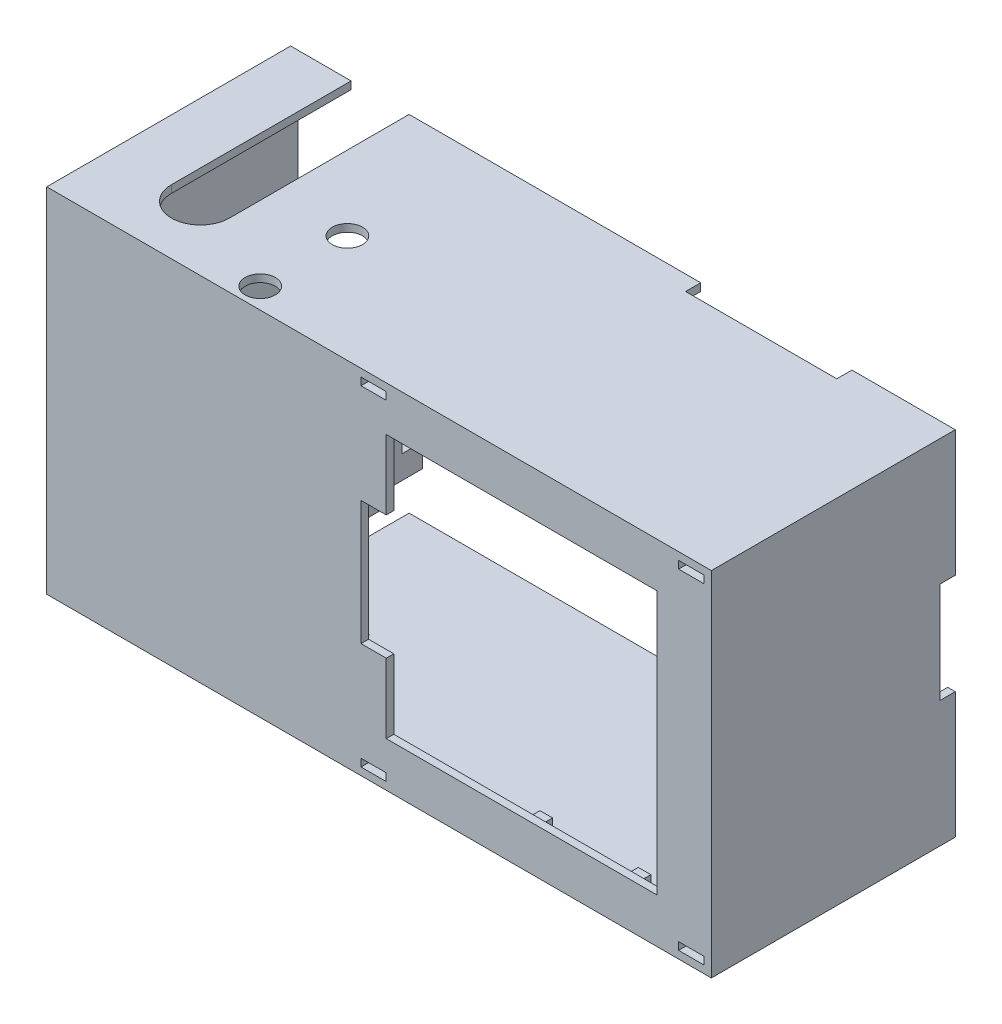
from build123d import *

# Parameters (mm, degrees)
SKETCH1_W                 = 131.85
SKETCH1_H                 = 70
BOSS_EXTRUDE1_DEPTH       = 1.5
SKETCH1_5_W               = 131.85
SKETCH1_5_H               = 70
SKETCH1_5_W_2             = 128.85
SKETCH1_5_H_2             = 67
BOSS_EXTRUDE2_DEPTH       = 46.887495
SKETCH2_W                 = 5.8
SKETCH2_H                 = 7.525
BOSS_EXTRUDE3_DEPTH       = 67
CAVITY1_START             = -114.930353249
CAVITY1_DEPTH             = 49.266
CAVITY1_2_DEPTH           = 37.332
CAVITY1_START_2           = -120.030353249
CAVITY1_3_OUTLINE_W       = 2.55
CAVITY1_3_OUTLINE_H       = 5.1
CAVITY1_3_DEPTH           = 0.430353249
CAVITY1_START_3           = -9.75
CAVITY1_4_DEPTH           = 70
SKETCH5_W                 = 8.75
SKETCH5_H                 = 5
BOSS_EXTRUDE4_DEPTH       = 22.5
CUT_EXTRUDE3_REACH        = 139.739
SKETCH6_R                 = 1.5
SKETCH6_R_2               = 1
CUT_EXTRUDE18_DEPTH       = 1.15
CUT_EXTRUDE18_DEPTH_BACK  = 1.15
CUT_EXTRUDE18_START       = -2.5
CUT_EXTRUDE19_DEPTH       = 1.15
CUT_EXTRUDE19_DEPTH_BACK  = 1.15
CUT_EXTRUDE19_START       = -19.7
SKETCH9_W                 = 32.1
SKETCH9_H                 = 12.2
SKETCH9_W_2               = 3.3625
BOSS_EXTRUDE5_DEPTH       = 40.087495374
SKETCH10_W                = 22.5
SKETCH10_H                = 15.7
CUT_EXTRUDE6_DEPTH        = 12.2
SKETCH11_R                = 0.75
CUT_EXTRUDE7_DEPTH        = 8
CUT_EXTRUDE9_REACH        = 149.525
SKETCH17_W                = 2.4375
SKETCH17_H                = 12.2
CUT_EXTRUDE13_DEPTH       = 7.525
SKETCH20_W                = 2.5
SKETCH20_H                = 3
BOSSBATTERYSTUBS_DEPTH    = 5.75
MIRROR10_COPY_1_SKETCH_W  = 2.5
MIRROR10_COPY_1_SKETCH_H  = 3
MIRROR10_COPY_1_DEPTH     = 5.75
SKETCH21_W                = 8
SKETCH21_H                = 4.2
BODYTOPCANTPOSBOSS_DEPTH  = 1.35
MIRROR12_COPY_1_SKETCH_W  = 8
MIRROR12_COPY_1_SKETCH_H  = 4.2
MIRROR12_COPY_1_DEPTH     = 1.35
PCBHOLDERCANTNEGCUT_REACH = 145.655
SKETCH22_W                = 5
SKETCH22_H                = 1.5
SKETCH23_W                = 5
SKETCH23_H                = 1.5
CUT_EXTRUDE17_DEPTH       = 3
PCBHOLDERACCESSCUT_REACH  = 145.156
CUT_EXTRUDE15_START       = -5.25
SKETCH19_R                = 3
CUT_EXTRUDE15_DEPTH       = 5.25
CUT_EXTRUDE24_START       = -5.25
SKETCH28_R                = 3
CUT_EXTRUDE24_DEPTH       = 5.25
CUT_EXTRUDE25_REACH       = 117.926
SKETCH29_W                = 8
SKETCH29_H                = 3
SKETCH30_W                = 5.1
SKETCH30_H                = 2.55
BOSSFRONTCAVITYFIX_DEPTH  = 0.430353249
CUT_EXTRUDE26_DEPTH       = 4.8
CUT_EXTRUDE27_REACH       = 149.525
SKETCH32_W                = 30
SKETCH32_H                = 3
CUT_EXTRUDE28_REACH       = 154.358
SKETCH33_W                = 3
SKETCH33_H                = 20


# Read off the part's stored shape, not the designer's step: Cavity1
with BuildPart() as part:
    # Sketch1 → Boss-Extrude1 (new body)
    with BuildSketch(Plane.XY):
        with Locations((-55.175, 25.25)):
            Rectangle(SKETCH1_W, SKETCH1_H)
    extrude(amount=BOSS_EXTRUDE1_DEPTH)

    # Sketch1<5> → Boss-Extrude2 (add)
    with BuildSketch(Plane.XY):
        with Locations((-55.175, 25.25)):
            Rectangle(SKETCH1_5_W, SKETCH1_5_H)
        with Locations((-55.175, 25.25)):
            Rectangle(SKETCH1_5_W_2, SKETCH1_5_H_2, mode=Mode.SUBTRACT)
    extrude(amount=-BOSS_EXTRUDE2_DEPTH)

    # Sketch2 → Boss-Extrude3 (add)
    with BuildSketch(Plane.XZ.offset(-58.75)):
        with Locations((-76.95, -3.7625)):
            Rectangle(SKETCH2_W, SKETCH2_H)
    extrude(amount=BOSS_EXTRUDE3_DEPTH)

    # Cavity1 outline → Cavity1 (cut)
    with BuildSketch(Plane.YZ.offset(CAVITY1_START)):
        with BuildLine():
            Line((36.166540929, -4.011412776), (36.166540929, -7.525))
            Line((36.166540929, -7.525), (53.710540929, -7.525))
            Line((53.710540929, -7.525), (53.710540929, -4.011412776))
            ThreePointArc((53.710540929, -4.011412776), (44.938540929, 0.123), (36.166540929, -4.011412776))
        make_face()
        with BuildLine():
            Line((14.333459071, -7.525), (14.333459071, -4.011412776))
            ThreePointArc((14.333459071, -4.011412776), (5.561459071, 0.123), (-3.210540929, -4.011412776))
            Line((-3.210540929, -4.011412776), (-3.210540929, -7.525))
            Line((-3.210540929, -7.525), (14.333459071, -7.525))
        make_face()
    extrude(amount=CAVITY1_DEPTH, mode=Mode.SUBTRACT)

    # Cavity1 2 outline → Cavity1 2 (cut)
    with BuildSketch(Plane.YZ.offset(CAVITY1_START)):
        with BuildLine():
            Line((55.189540929, 0.225), (36.166540929, 0.225))
            Line((36.166540929, 0.225), (36.166540929, -4.011412776))
            ThreePointArc((36.166540929, -4.011412776), (44.938540929, 0.123), (53.710540929, -4.011412776))
            Line((53.710540929, -4.011412776), (53.710540929, -7.525))
            Line((53.710540929, -7.525), (55.189540929, -7.525))
            Line((55.189540929, -7.525), (55.189540929, 0.225))
        make_face()
        with BuildLine():
            Line((14.333459071, -4.011412776), (14.333459071, 0.225))
            Line((14.333459071, 0.225), (-4.689540929, 0.225))
            Line((-4.689540929, 0.225), (-4.689540929, -7.525))
            Line((-4.689540929, -7.525), (-3.210540929, -7.525))
            Line((-3.210540929, -7.525), (-3.210540929, -4.011412776))
            ThreePointArc((-3.210540929, -4.011412776), (5.561459071, 0.123), (14.333459071, -4.011412776))
        make_face()
    extrude(amount=CAVITY1_2_DEPTH, mode=Mode.SUBTRACT)

    # Cavity1 3 outline → Cavity1 3 (cut)
    with BuildSketch(Plane.YZ.offset(CAVITY1_START_2)):
        with Locations((44.938540929, -11.25)):
            Rectangle(CAVITY1_3_OUTLINE_W, CAVITY1_3_OUTLINE_H)
        with Locations((5.561459071, -11.25)):
            Rectangle(CAVITY1_3_OUTLINE_W, CAVITY1_3_OUTLINE_H)
    extrude(amount=CAVITY1_3_DEPTH, mode=Mode.SUBTRACT)

    # Cavity1 4 outline → Cavity1 4 (cut)
    with BuildSketch(Plane(origin=(0, 0, 0), x_dir=(1, 0, 0), z_dir=(0, 1, 0)).offset(CAVITY1_START_3)):
        with BuildLine():
            Line((-105.571853249, 13.174532151), (-105.571853249, 9.325467849))
            ThreePointArc((-105.571853249, 9.325467849), (-103.710353249, 8.5725), (-101.848853249, 9.325467849))
            Line((-101.848853249, 9.325467849), (-101.848853249, 13.174532151))
            ThreePointArc((-101.848853249, 13.174532151), (-103.710353249, 13.9275), (-105.571853249, 13.174532151))
        make_face()
    extrude(amount=CAVITY1_4_DEPTH, mode=Mode.SUBTRACT)

    # Sketch5 → Boss-Extrude4 (add)
    with BuildSketch(Plane(origin=(0, 0, 0), x_dir=(-1, 0, 0), z_dir=(0, 0, -1))):
        with Locations((82.85, 33.85)):
            Rectangle(SKETCH5_W, SKETCH5_H)
    boss_extrude4 = extrude(amount=BOSS_EXTRUDE4_DEPTH)

    # Sketch6 → Cut-Extrude3 (cut, up to next)
    with BuildSketch(Plane(origin=(0, 36.166540929, 0), x_dir=(1, 0, 0), z_dir=(0, 1, 0)), mode=Mode.PRIVATE) as cut_extrude3_sk1:
        with Locations(Location((-82.85, 19.9, 0), (0, 0, 270))):
            Circle(SKETCH6_R)
    cut_extrude3_tool1 = extrude(cut_extrude3_sk1.sketch, amount=-CUT_EXTRUDE3_REACH, mode=Mode.PRIVATE) & part.part
    # Sketch6 → Cut-Extrude3 (cut, up to next)
    with BuildSketch(Plane(origin=(0, 36.166540929, 0), x_dir=(1, 0, 0), z_dir=(0, 1, 0)), mode=Mode.PRIVATE) as cut_extrude3_sk2:
        with Locations(Location((-82.85, 2.6, 0), (0, 0, 270))):
            Circle(SKETCH6_R_2)
    cut_extrude3_tool2 = extrude(cut_extrude3_sk2.sketch, amount=-CUT_EXTRUDE3_REACH, mode=Mode.PRIVATE) & part.part
    cut_extrude3_1 = cut_extrude3_tool1.solids().sort_by_distance((-82.85, 36.166541, -19.9))[0]
    add(cut_extrude3_1, mode=Mode.SUBTRACT)
    cut_extrude3_2 = cut_extrude3_tool2.solids().sort_by_distance((-82.85, 36.166541, -2.6))[0]
    add(cut_extrude3_2, mode=Mode.SUBTRACT)
    cut_extrude3 = cut_extrude3_1 + cut_extrude3_2  # Cut-Extrude3 as one shape, for the pattern or mirror that repeats it

    # Sketch24 → Cut-Extrude18 (cut, two sides: drawn at the far end of the back side and taken through both)
    with BuildSketch(Plane(origin=(0, 36.35, 0), x_dir=(1, 0, 0), z_dir=(0, 1, 0)).offset(CUT_EXTRUDE18_START - CUT_EXTRUDE18_DEPTH_BACK)):
        Polygon((-82.85, 16.637970979), (-80.025, 18.26898549), (-80.025, 22.5), (-85.675, 22.5), (-85.675, 18.26898549), align=None)
    extrude(amount=CUT_EXTRUDE18_DEPTH + CUT_EXTRUDE18_DEPTH_BACK, mode=Mode.SUBTRACT)

    # Mirror15: Boss-Extrude4, Cut-Extrude3 across plane
    add(boss_extrude4.mirror(Plane(origin=(0, 25.25, 0), x_dir=(0, 0, 1), z_dir=(0, -1, 0))))
    add(cut_extrude3.mirror(Plane(origin=(0, 25.25, 0), x_dir=(0, 0, 1), z_dir=(0, -1, 0))), mode=Mode.SUBTRACT)

    # Sketch24<2> → Cut-Extrude19 (cut, two sides: drawn at the far end of the back side and taken through both)
    with BuildSketch(Plane(origin=(0, 36.35, 0), x_dir=(1, 0, 0), z_dir=(0, 1, 0)).offset(CUT_EXTRUDE19_START - CUT_EXTRUDE19_DEPTH_BACK)):
        Polygon((-82.85, 16.637970979), (-80.025, 18.26898549), (-80.025, 22.5), (-85.675, 22.5), (-85.675, 18.26898549), align=None)
    extrude(amount=CUT_EXTRUDE19_DEPTH + CUT_EXTRUDE19_DEPTH_BACK, mode=Mode.SUBTRACT)

    # Sketch9 → Boss-Extrude5 (add)
    with BuildSketch(Plane(origin=(0, 0, 0), x_dir=(-1, 0, 0), z_dir=(0, 0, -1))):
        with Locations((92.5375, 25.25)):
            Rectangle(SKETCH9_W, SKETCH9_H)
        with Locations((78.16875, 25.25)):
            Rectangle(SKETCH9_W_2, SKETCH9_H)
    extrude(amount=BOSS_EXTRUDE5_DEPTH)

    # Sketch10 → Cut-Extrude6 (cut)
    with BuildSketch(Plane(origin=(0, 31.35, 0), x_dir=(1, 0, 0), z_dir=(0, 1, 0))):
        with Locations((-92.5375, 32.237495374)):
            Rectangle(SKETCH10_W, SKETCH10_H)
    extrude(amount=-CUT_EXTRUDE6_DEPTH, mode=Mode.SUBTRACT)

    # Sketch11 → Cut-Extrude7 (cut)
    with BuildSketch(Plane(origin=(0, 0, -40.087495374), x_dir=(-1, 0, 0), z_dir=(0, 0, -1))):
        with Locations((106.1875, 25.25)):
            Circle(SKETCH11_R)
    cut_extrude7 = extrude(amount=-CUT_EXTRUDE7_DEPTH, mode=Mode.SUBTRACT)

    # Sketch13 → Cut-Extrude9 (cut, up to next)
    with BuildSketch(Plane(origin=(0, 60.25, 0), x_dir=(1, 0, 0), z_dir=(0, 1, 0)), mode=Mode.PRIVATE) as cut_extrude9_sk1:
        with BuildLine():
            Line((-109.1, 46.887495374), (-109.1, 11.25))
            ThreePointArc((-109.1, 11.25), (-103.35, 5.5), (-97.6, 11.25))
            Line((-97.6, 11.25), (-97.6, 46.887495374))
            Line((-97.6, 46.887495374), (-109.1, 46.887495374))
        make_face()
        with BuildLine():
            Line((-105.571853249, 9.325467849), (-105.571853249, 13.174532151))
            ThreePointArc((-105.571853249, 13.174532151), (-103.710353249, 13.9275), (-101.848853249, 13.174532151))
            Line((-101.848853249, 13.174532151), (-101.848853249, 9.325467849))
            ThreePointArc((-101.848853249, 9.325467849), (-103.710353249, 8.5725), (-105.571853249, 9.325467849))
        make_face(mode=Mode.SUBTRACT)
    cut_extrude9_tool1 = extrude(cut_extrude9_sk1.sketch, amount=-CUT_EXTRUDE9_REACH, mode=Mode.PRIVATE) & part.part
    cut_extrude9 = cut_extrude9_tool1.solids().sort_by_distance((-103.335225, 60.25, -27.427392))[0]
    add(cut_extrude9, mode=Mode.SUBTRACT)

    # Mirror4: Cut-Extrude9 across plane
    add(cut_extrude9.mirror(Plane(origin=(0, 25.25, 0), x_dir=(0, 0, 1), z_dir=(0, -1, 0))), mode=Mode.SUBTRACT)

    # Sketch17 → Cut-Extrude13 (cut)
    with BuildSketch(Plane(origin=(0, 0, -7.525), x_dir=(-1, 0, 0), z_dir=(0, 0, -1))):
        with Locations((75.26875, 25.25)):
            Rectangle(SKETCH17_W, SKETCH17_H)
    extrude(amount=-CUT_EXTRUDE13_DEPTH, mode=Mode.SUBTRACT)

    # Sketch20 → BossBatteryStubs (add)
    with BuildSketch(Plane(origin=(0, 0, 0), x_dir=(-1, 0, 0), z_dir=(0, 0, -1))):
        with Locations((29.25, 57.25)):
            Rectangle(SKETCH20_W, SKETCH20_H)
    bossbatterystubs = extrude(amount=BOSSBATTERYSTUBS_DEPTH)

    # Mirror9: BossBatteryStubs across plane
    add(bossbatterystubs.mirror(Plane.ZY.offset(19.5)))

    # Mirror10: BossBatteryStubs across plane
    add(bossbatterystubs.mirror(Plane(origin=(0, 25.25, 0), x_dir=(0, 0, 1), z_dir=(0, -1, 0))))

    # Mirror10 copy 1 sketch → Mirror10 copy 1 (add)
    with BuildSketch(Plane(origin=(-39, 50.5, 0), x_dir=(1, 0, 0), z_dir=(0, 0, -1))):
        with Locations((29.25, 57.25)):
            Rectangle(MIRROR10_COPY_1_SKETCH_W, MIRROR10_COPY_1_SKETCH_H)
    extrude(amount=MIRROR10_COPY_1_DEPTH)

    # Sketch21 → bodyTopCantPosBoss (add)
    with BuildSketch(Plane.XZ.offset(-58.75)):
        with Locations((-115.6, -41.637495374)):
            Rectangle(SKETCH21_W, SKETCH21_H)
    bodytopcantposboss = extrude(amount=BODYTOPCANTPOSBOSS_DEPTH)

    # Mirror11: bodyTopCantPosBoss across plane
    add(bodytopcantposboss.mirror(Plane(origin=(-55.175, 0, 0), x_dir=(0, 0, 1), z_dir=(1, 0, 0))))

    # Mirror12: bodyTopCantPosBoss across plane
    add(bodytopcantposboss.mirror(Plane(origin=(0, 25.25, 0), x_dir=(0, 0, 1), z_dir=(0, -1, 0))))

    # Mirror12 copy 1 sketch → Mirror12 copy 1 (add)
    with BuildSketch(Plane(origin=(-110.35, -8.25, 0), x_dir=(-1, 0, 0), z_dir=(0, 1, 0))):
        with Locations((-115.6, -41.637495374)):
            Rectangle(MIRROR12_COPY_1_SKETCH_W, MIRROR12_COPY_1_SKETCH_H)
    extrude(amount=MIRROR12_COPY_1_DEPTH)

    # Sketch22 → pcbHolderCantNegCut (cut, up to next)
    with BuildSketch(Plane.XY.offset(1.5), mode=Mode.PRIVATE) as pcbholdercantnegcut_sk1:
        with Locations((6.75, 58)):
            Rectangle(SKETCH22_W, SKETCH22_H)
    pcbholdercantnegcut_tool1 = extrude(pcbholdercantnegcut_sk1.sketch, amount=-PCBHOLDERCANTNEGCUT_REACH, mode=Mode.PRIVATE) & part.part
    pcbholdercantnegcut = pcbholdercantnegcut_tool1.solids().sort_by_distance((6.75, 58, 1.5))[0]
    add(pcbholdercantnegcut, mode=Mode.SUBTRACT)

    # Sketch23 → Cut-Extrude17 (cut)
    with BuildSketch(Plane.XY.offset(1.5)):
        with Locations((-56.25, 58)):
            Rectangle(SKETCH23_W, SKETCH23_H)
    cut_extrude17 = extrude(amount=-CUT_EXTRUDE17_DEPTH, mode=Mode.SUBTRACT)

    # Mirror13: pcbHolderCantNegCut, Cut-Extrude17 across plane
    add(pcbholdercantnegcut.mirror(Plane(origin=(0, 25.25, 0), x_dir=(0, 0, 1), z_dir=(0, -1, 0))), mode=Mode.SUBTRACT)
    add(cut_extrude17.mirror(Plane(origin=(0, 25.25, 0), x_dir=(0, 0, 1), z_dir=(0, -1, 0))), mode=Mode.SUBTRACT)

    # Mirror14: Cut-Extrude7 across plane
    add(cut_extrude7.mirror(Plane(origin=(-92.5375, 0, 0), x_dir=(0, 0, 1), z_dir=(1, 0, 0))), mode=Mode.SUBTRACT)

    # Sketch27 → pcbHolderAccessCut (cut, up to next)
    with BuildSketch(Plane(origin=(0, 0, 0), x_dir=(-1, 0, 0), z_dir=(0, 0, -1)), mode=Mode.PRIVATE) as pcbholderaccesscut_sk1:
        Polygon((58.75, 37.55), (58.75, 12.95), (53.75, 12.95), (53.75, -0.875), (0, -0.875), (0, 51.375), (53.75, 51.375), (53.75, 37.55), align=None)
    pcbholderaccesscut_tool1 = extrude(pcbholderaccesscut_sk1.sketch, amount=-PCBHOLDERACCESSCUT_REACH, mode=Mode.PRIVATE) & part.part
    add(pcbholderaccesscut_tool1.solids().sort_by_distance((-28.107544, 25.25, 0))[0], mode=Mode.SUBTRACT)

    # Sketch19 → Cut-Extrude15 (cut)
    with BuildSketch(Plane.XZ.offset(9.75).offset(CUT_EXTRUDE15_START)):
        with Locations((-82.85, -19.9)):
            Circle(SKETCH19_R)
        with Locations((-82.85, -2.6)):
            Circle(SKETCH19_R)
    extrude(amount=CUT_EXTRUDE15_DEPTH, mode=Mode.SUBTRACT)

    # Sketch28 → Cut-Extrude24 (cut)
    with BuildSketch(Plane(origin=(0, 60.25, 0), x_dir=(1, 0, 0), z_dir=(0, 1, 0)).offset(CUT_EXTRUDE24_START)):
        with Locations((-82.85, 19.9)):
            Circle(SKETCH28_R)
        with Locations((-82.85, 2.6)):
            Circle(SKETCH28_R)
    extrude(amount=CUT_EXTRUDE24_DEPTH, mode=Mode.SUBTRACT)

    # Sketch29 → Cut-Extrude25 (cut, up to next)
    with BuildSketch(Plane(origin=(-76.4875, 0, 0), x_dir=(0, 0, -1), z_dir=(1, 0, 0)), mode=Mode.PRIVATE) as cut_extrude25_sk1:
        with Locations((28.387495374, 25.25)):
            Rectangle(SKETCH29_W, SKETCH29_H)
    cut_extrude25_tool1 = extrude(cut_extrude25_sk1.sketch, amount=-CUT_EXTRUDE25_REACH, mode=Mode.PRIVATE) & part.part
    add(cut_extrude25_tool1.solids().sort_by_distance((-76.4875, 25.25, -28.387495))[0], mode=Mode.SUBTRACT)

    # Sketch30 → BossFrontCavityFix (add)
    with BuildSketch(Plane(origin=(-120.030353249, 0, 0), x_dir=(0, 0, -1), z_dir=(1, 0, 0))):
        with Locations((11.25, 44.938540929)):
            Rectangle(SKETCH30_W, SKETCH30_H)
        with Locations((11.25, 5.561459071)):
            Rectangle(SKETCH30_W, SKETCH30_H)
    extrude(amount=BOSSFRONTCAVITYFIX_DEPTH)

    # Sketch31 → Cut-Extrude26 (cut)
    with BuildSketch(Plane(origin=(-76.4875, 0, 0), x_dir=(0, 0, -1), z_dir=(1, 0, 0))):
        Polygon((40.087495374, 19.15), (28.387495374, 19.15), (28.387495374, 23.75), (28.387495374, 26.75), (28.387495374, 31.35), (40.087495374, 31.35), align=None)
    extrude(amount=-CUT_EXTRUDE26_DEPTH, mode=Mode.SUBTRACT)

    # Sketch32 → Cut-Extrude27 (cut, up to next)
    with BuildSketch(Plane.XZ.offset(9.75), mode=Mode.PRIVATE) as cut_extrude27_sk1:
        with Locations((-24.75, -45.387495374)):
            Rectangle(SKETCH32_W, SKETCH32_H)
    cut_extrude27_tool1 = extrude(cut_extrude27_sk1.sketch, amount=-CUT_EXTRUDE27_REACH, mode=Mode.PRIVATE) & part.part
    cut_extrude27 = cut_extrude27_tool1.solids().sort_by_distance((-24.75, -9.75, -45.387495))[0]
    add(cut_extrude27, mode=Mode.SUBTRACT)

    # Mirror16: Cut-Extrude27 across plane
    add(cut_extrude27.mirror(Plane(origin=(0, 25.25, 0), x_dir=(0, 0, 1), z_dir=(0, -1, 0))), mode=Mode.SUBTRACT)

    # Sketch33 → Cut-Extrude28 (cut, up to next)
    with BuildSketch(Plane(origin=(10.75, 0, 0), x_dir=(0, 0, -1), z_dir=(1, 0, 0)), mode=Mode.PRIVATE) as cut_extrude28_sk1:
        with Locations((45.387495374, 25.25)):
            Rectangle(SKETCH33_W, SKETCH33_H)
    cut_extrude28_tool1 = extrude(cut_extrude28_sk1.sketch, amount=-CUT_EXTRUDE28_REACH, mode=Mode.PRIVATE) & part.part
    cut_extrude28 = cut_extrude28_tool1.solids().sort_by_distance((10.75, 25.25, -45.387495))[0]
    add(cut_extrude28, mode=Mode.SUBTRACT)

    # Mirror17: Cut-Extrude28 across plane
    add(cut_extrude28.mirror(Plane(origin=(-55.175, 0, 0), x_dir=(0, 0, 1), z_dir=(1, 0, 0))), mode=Mode.SUBTRACT)


solid = part.part
